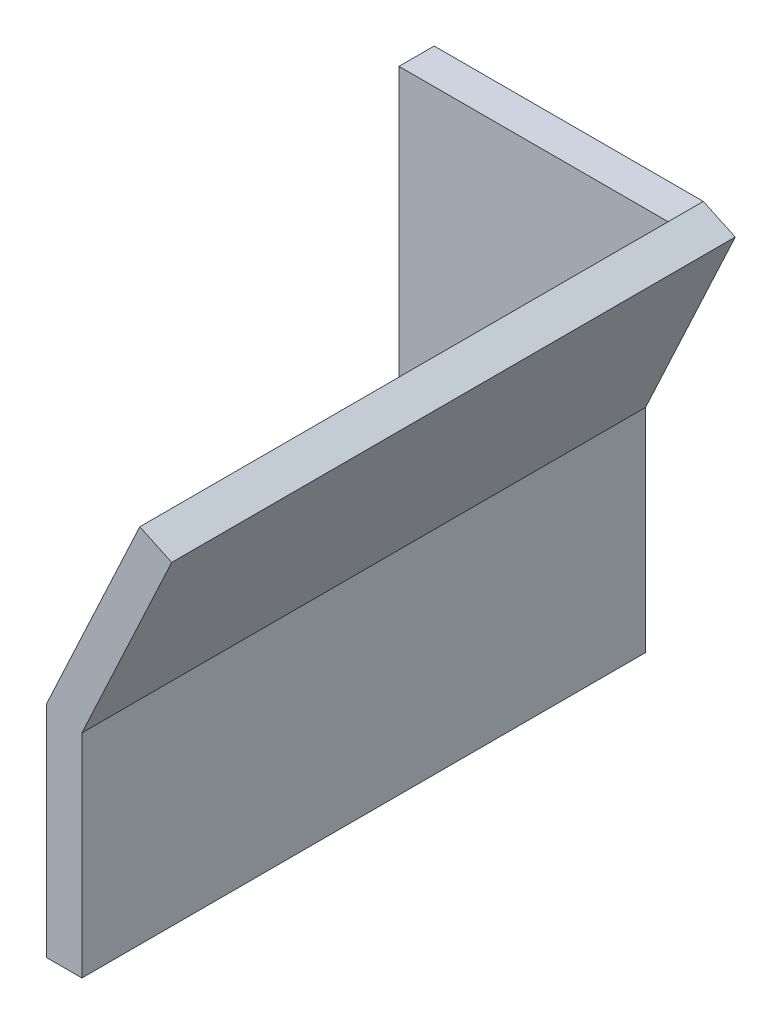
from build123d import *

# Parameters (mm, degrees)
BRKT_4_5_BOSS_EXTRUDE1_START = -60
BRKT_4_5_BOSS_EXTRUDE1_DEPTH = 120
BOSS_EXTRUDE1_DEPTH          = 8


# Read off the part's stored shape, not the designer's step: <BRKT_4_5>-<Boss-Extrude1>
with BuildPart() as part:
    # <BRKT_4_5>-<Boss-Extrude1> outline → <BRKT_4_5>-<Boss-Extrude1> (new body)
    with BuildSketch(Plane.XY.offset(BRKT_4_5_BOSS_EXTRUDE1_START)):
        Polygon((0, 0), (0, -50), (8, -50), (8, -1.773557301), (28.381375383, 41.934443258), (21.130913087, 45.315389352), align=None)
    extrude(amount=BRKT_4_5_BOSS_EXTRUDE1_DEPTH)

    # Sketch1 → Boss-Extrude1 (add)
    with BuildSketch(Plane(origin=(0, 0, -60), x_dir=(-1, 0, 0), z_dir=(0, 0, -1))):
        Polygon((-28.381375383, 41.934443258), (-21.130913087, 45.315389352), (40, 45.315389352), (40, -50), (0, -50), (-8, -50), (-8, -1.773557301), align=None)
    extrude(amount=BOSS_EXTRUDE1_DEPTH)


solid = part.part
